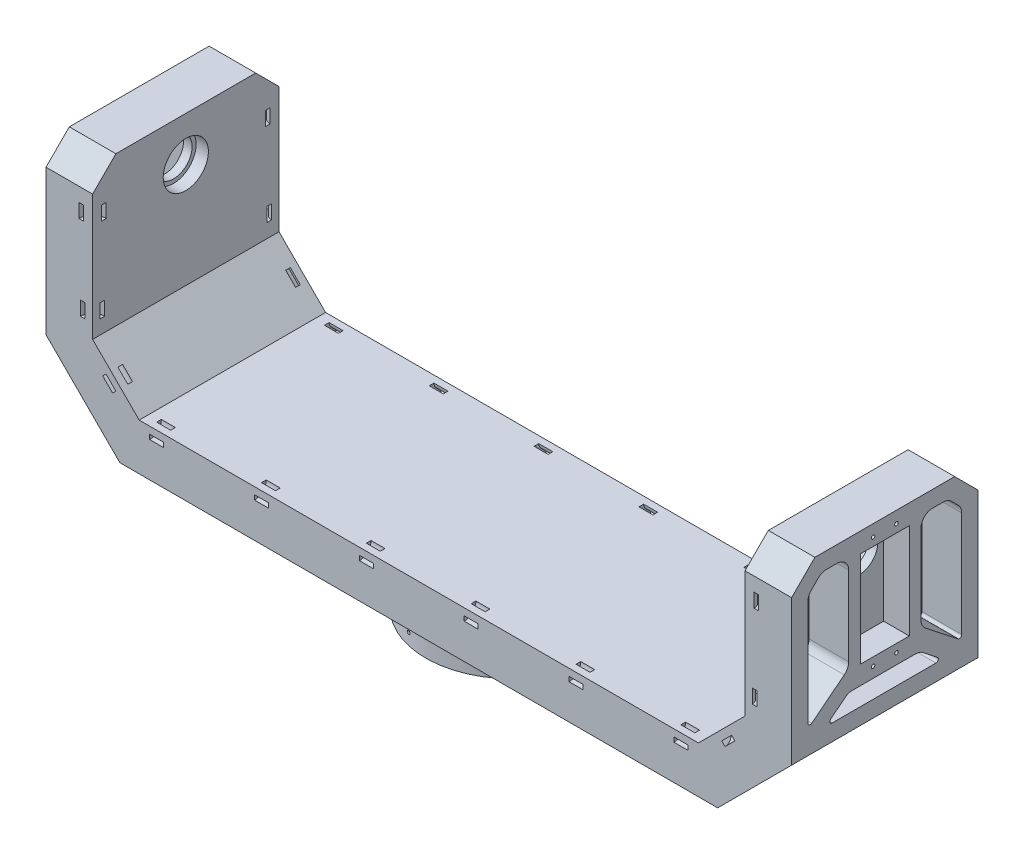
from build123d import *

# Parameters (mm, degrees)
EXTRUDE_1_DEPTH          = 40
CHAMFER_1_SIZE           = 10
SKETCH_3_R               = 0.75
CUT_EXTRUDE_1_DEPTH      = 10
SKETCH_4_W               = 21
SKETCH_4_H               = 41
CUT_EXTRUDE_2_DEPTH      = 11
SKETCH_8_R               = 37
SKETCH_8_R_2             = 33
EXTRUDE_2_DEPTH          = 10
CUT_EXTRUDE_4_DEPTH      = 18.5
SKETCH_9_W               = 7
SKETCH_9_H               = 20
EXTRUDE_3_DEPTH          = 6
SKETCH_10_W              = 8
SKETCH_10_H              = 20
CUT_EXTRUDE_5_DEPTH      = 10.5
SKETCH_11_R              = 0.75
CUT_EXTRUDE_6_DEPTH      = 10.5
PATTERN_CIRCULAR_1_COUNT = 7
CUT_EXTRUDE_7_DEPTH      = 17
CUT_EXTRUDE_8_DEPTH      = 15
CUT_EXTRUDE_START        = -17
CUT_EXTRUDE_9_DEPTH      = 17
CUT_EXTRUDE_10_DEPTH     = 17
CUT_EXTRUDE_11_DEPTH     = 37
SKETCH_17_R              = 0.75
CUT_EXTRUDE_13_DEPTH     = 10
SKETCH_18_W              = 6
SKETCH_18_H              = 2
SKETCH_20_W              = 2
SKETCH_20_H              = 6
MIRROR_7_COPY_2_SKETCH_W = 2
MIRROR_7_COPY_2_SKETCH_H = 6


with BuildPart() as part:
    # Эскиз1 → Бобышка-Вытянуть1 (new, symmetric)
    with BuildSketch(Plane.XY):
        Polygon((0, 0), (120, 0), (140, 20), (140, 84), (160, 84), (160, 11.715728753), (128.284271247, -20), (0, -20), align=None)
    extrude_1 = extrude(amount=EXTRUDE_1_DEPTH, both=True)

    # Зеркальное отражение1: Бобышка-Вытянуть1 across plane
    add(extrude_1.mirror(Plane(origin=(0, 0, 0), x_dir=(0, 0, 1), z_dir=(1, 0, 0))))

    # Фаска1
    chamfer_1_edges = [part.edges().sort_by_distance(p)[0] for p in [
        (150, 84, 40),
        (150, 84, -40),
        (-150, 84, -40),
        (-150, 84, 40),
    ]]
    chamfer(chamfer_1_edges, length=CHAMFER_1_SIZE)

    # Эскиз2 → Вырез-Повернуть1 (revolve, cut)
    with BuildSketch(Plane.XY):
        Polygon((140, 74.7), (145.277502044, 74.7), (145.277502044, 73), (160, 73), (160, 65), (140, 65), align=None)
    cut_revolve_1 = revolve(axis=Axis((49.854666059, 65, 0), (1, 0, 0)), mode=Mode.SUBTRACT)

    # Зеркальное отражение2: Вырез-Повернуть1 across plane
    add(cut_revolve_1.mirror(Plane(origin=(0, 0, 0), x_dir=(0, 0, 1), z_dir=(1, 0, 0))), mode=Mode.SUBTRACT)

    # Эскиз3 → Вырез-Вытянуть1 (cut)
    with BuildSketch(Plane.ZY.offset(160)):
        with Locations((-5, 79)):
            Circle(SKETCH_3_R)
        with Locations((5, 79)):
            Circle(SKETCH_3_R)
        with Locations((-5, 31)):
            Circle(SKETCH_3_R)
        with Locations((5, 31)):
            Circle(SKETCH_3_R)
    cut_extrude_1 = extrude(amount=-CUT_EXTRUDE_1_DEPTH, mode=Mode.SUBTRACT)

    # Эскиз4 → Вырез-Вытянуть2 (cut)
    with BuildSketch(Plane.ZY.offset(160)):
        with Locations((0, 55)):
            Rectangle(SKETCH_4_W, SKETCH_4_H)
    cut_extrude_2 = extrude(amount=-CUT_EXTRUDE_2_DEPTH, mode=Mode.SUBTRACT)

    # Эскиз8 → Бобышка-Вытянуть2 (add)
    with BuildSketch(Plane.XZ.offset(20)):
        Circle(SKETCH_8_R)
        Circle(SKETCH_8_R_2, mode=Mode.SUBTRACT)
    extrude(amount=EXTRUDE_2_DEPTH)

    # Эскиз7 → Вырез-Вытянуть4 (cut)
    with BuildSketch(Plane.XZ.offset(20)):
        with BuildLine():
            Line((10, 10.5), (-30, 10.5))
            ThreePointArc((-30, 10.5), (-30.353553391, 10.353553391), (-30.5, 10))
            Line((-30.5, 10), (-30.5, -10))
            ThreePointArc((-30.5, -10), (-30.353553391, -10.353553391), (-30, -10.5))
            Line((-30, -10.5), (10, -10.5))
            ThreePointArc((10, -10.5), (10.353553391, -10.353553391), (10.5, -10))
            Line((10.5, -10), (10.5, 10))
            ThreePointArc((10.5, 10), (10.353553391, 10.353553391), (10, 10.5))
        make_face()
    extrude(amount=-CUT_EXTRUDE_4_DEPTH, mode=Mode.SUBTRACT)

    # Эскиз9 → Бобышка-Вытянуть3 (add)
    with BuildSketch(Plane.XZ.offset(20)):
        with Locations((-35, 0)):
            Rectangle(SKETCH_9_W, SKETCH_9_H)
        with Locations((15, 0)):
            Rectangle(SKETCH_9_W, SKETCH_9_H)
    extrude(amount=EXTRUDE_3_DEPTH)

    # Эскиз10 → Вырез-Вытянуть5 (cut)
    with BuildSketch(Plane.XZ.offset(26)):
        with Locations((-34.5, 0)):
            Rectangle(SKETCH_10_W, SKETCH_10_H)
    extrude(amount=CUT_EXTRUDE_5_DEPTH, mode=Mode.SUBTRACT)

    # Эскиз11 → Вырез-Вытянуть6 (cut)
    with BuildSketch(Plane(origin=(40, 0, 0), x_dir=(0, 0, -1), z_dir=(1, 0, 0))):
        with Locations((0, -25)):
            Circle(SKETCH_11_R)
    cut_extrude_6 = extrude(amount=-CUT_EXTRUDE_6_DEPTH, mode=Mode.SUBTRACT)

    # Круговой массив1: Вырез-Вытянуть6 ×7 about axis
    pattern_circular_1_axis = Axis((0, -30, 0), (0, 1, 0))
    for i in range(1, PATTERN_CIRCULAR_1_COUNT):
        add(cut_extrude_6.rotate(pattern_circular_1_axis, i * 360 / PATTERN_CIRCULAR_1_COUNT), mode=Mode.SUBTRACT)

    # Зеркальное отражение3: Вырез-Вытянуть1, Вырез-Вытянуть2 across plane
    add(cut_extrude_1.mirror(Plane(origin=(0, 0, 0), x_dir=(0, 0, 1), z_dir=(1, 0, 0))), mode=Mode.SUBTRACT)
    add(cut_extrude_2.mirror(Plane(origin=(0, 0, 0), x_dir=(0, 0, 1), z_dir=(1, 0, 0))), mode=Mode.SUBTRACT)

    # Эскиз12 → Вырез-Вытянуть7 (cut)
    with BuildSketch(Plane.ZY.offset(160)):
        with BuildLine():
            Line((-31.535533906, 72.564971157), (-28.564971157, 75.535533906))
            ThreePointArc((-28.564971157, 75.535533906), (-26.942854413, 76.619397663), (-25.029437252, 77))
            Line((-25.029437252, 77), (-20.5, 77))
            ThreePointArc((-20.5, 77), (-16.964466094, 75.535533906), (-15.5, 72))
            Line((-15.5, 72), (-15.5, 37.93574072))
            ThreePointArc((-15.5, 37.93574072), (-16.000612532, 35.755026981), (-17.402204965, 34.010990293))
            Line((-17.402204965, 34.010990293), (-31.380440993, 22.978005912))
            ThreePointArc((-31.380440993, 22.978005912), (-32.436142748, 22.863078504), (-33, 23.762955997))
            Line((-33, 23.762955997), (-33, 69.029437252))
            ThreePointArc((-33, 69.029437252), (-32.619397663, 70.942854413), (-31.535533906, 72.564971157))
        make_face()
        with BuildLine():
            Line((22.601171863, 18.715728753), (-21.967697023, 18.715728753))
            ThreePointArc((-21.967697023, 18.715728753), (-22.912405995, 19.387818769), (-22.58725603, 20.500678838))
            Line((-22.58725603, 20.500678838), (-16.348705106, 25.424750428))
            ThreePointArc((-16.348705106, 25.424750428), (-14.890459988, 26.223544863), (-13.250910071, 26.5))
            Line((-13.250910071, 26.5), (13.884384911, 26.5))
            ThreePointArc((13.884384911, 26.5), (15.523934828, 26.223544863), (16.982179946, 25.424750428))
            Line((16.982179946, 25.424750428), (23.22073087, 20.500678838))
            ThreePointArc((23.22073087, 20.500678838), (23.545880835, 19.387818769), (22.601171863, 18.715728753))
        make_face()
        with BuildLine():
            Line((33, 23.762955997), (33, 69.029437252))
            ThreePointArc((33, 69.029437252), (32.619397663, 70.942854413), (31.535533906, 72.564971157))
            Line((31.535533906, 72.564971157), (28.564971157, 75.535533906))
            ThreePointArc((28.564971157, 75.535533906), (26.942854413, 76.619397663), (25.029437252, 77))
            Line((25.029437252, 77), (20.5, 77))
            ThreePointArc((20.5, 77), (16.964466094, 75.535533906), (15.5, 72))
            Line((15.5, 72), (15.5, 37.93574072))
            ThreePointArc((15.5, 37.93574072), (16.000612532, 35.755026981), (17.402204965, 34.010990293))
            Line((17.402204965, 34.010990293), (31.380440993, 22.978005912))
            ThreePointArc((31.380440993, 22.978005912), (32.436142748, 22.863078504), (33, 23.762955997))
        make_face()
    cut_extrude_7 = extrude(amount=-CUT_EXTRUDE_7_DEPTH, mode=Mode.SUBTRACT)

    # Эскиз13 → Вырез-Вытянуть8 (cut)
    with BuildSketch(Plane(origin=(-74.142135624, -74.142135624, 0), x_dir=(0, 0, 1), z_dir=(-0.7071067811865477, -0.7071067811865475, 0))):
        with BuildLine():
            Line((-16.529437252, 114.421356237), (16.529437252, 114.421356237))
            ThreePointArc((16.529437252, 114.421356237), (17.496975473, 113.67408097), (17.018478928, 112.549095818))
            Line((17.018478928, 112.549095818), (1.467125029, 103.83007107))
            ThreePointArc((1.467125029, 103.83007107), (0, 103.446852327), (-1.467125029, 103.83007107))
            Line((-1.467125029, 103.83007107), (-17.018478928, 112.549095818))
            ThreePointArc((-17.018478928, 112.549095818), (-17.496975473, 113.67408097), (-16.529437252, 114.421356237))
        make_face()
        with BuildLine():
            Line((1.467125029, 94.159827662), (17.018478928, 85.440802914))
            ThreePointArc((17.018478928, 85.440802914), (17.496975473, 84.315817762), (16.529437252, 83.568542495))
            Line((16.529437252, 83.568542495), (-16.529437252, 83.568542495))
            ThreePointArc((-16.529437252, 83.568542495), (-17.496975473, 84.315817762), (-17.018478928, 85.440802914))
            Line((-17.018478928, 85.440802914), (-1.467125029, 94.159827662))
            ThreePointArc((-1.467125029, 94.159827662), (0, 94.543046405), (1.467125029, 94.159827662))
        make_face()
        with BuildLine():
            Line((8.712628073, 98.122688947), (31.510958324, 85.340573192))
            ThreePointArc((31.510958324, 85.340573192), (32.505449465, 85.349977402), (33, 86.212833611))
            Line((33, 86.212833611), (33, 111.777065121))
            ThreePointArc((33, 111.777065121), (32.505449465, 112.63992133), (31.510958324, 112.64932554))
            Line((31.510958324, 112.64932554), (8.712628073, 99.867209785))
            ThreePointArc((8.712628073, 99.867209785), (8.201669749, 98.994949366), (8.712628073, 98.122688947))
        make_face()
        with BuildLine():
            Line((-31.510958324, 112.64932554), (-8.712628073, 99.867209785))
            ThreePointArc((-8.712628073, 99.867209785), (-8.201669749, 98.994949366), (-8.712628073, 98.122688947))
            Line((-8.712628073, 98.122688947), (-31.510958324, 85.340573192))
            ThreePointArc((-31.510958324, 85.340573192), (-32.505449465, 85.349977402), (-33, 86.212833611))
            Line((-33, 86.212833611), (-33, 111.777065121))
            ThreePointArc((-33, 111.777065121), (-32.505449465, 112.63992133), (-31.510958324, 112.64932554))
        make_face()
    cut_extrude_8 = extrude(amount=-CUT_EXTRUDE_8_DEPTH, mode=Mode.SUBTRACT)

    # Эскиз14 → Вырез-Вытянуть9 (cut)
    with BuildSketch(Plane.XZ.offset(20).offset(CUT_EXTRUDE_START)):
        with BuildLine():
            Line((-59.772989655, 1.691213331), (-37.427100322, 15.797512634))
            ThreePointArc((-37.427100322, 15.797512634), (-35.088117188, 15.650196296), (-34.49489825, 13.382899339))
            ThreePointArc((-34.49489825, 13.382899339), (-35.099741259, 11.705048636), (-35.623026261, 10))
            Line((-35.623026261, 10), (-38.5, 10))
            Line((-38.5, 10), (-38.5, -10))
            Line((-38.5, -10), (-35.623026261, -10))
            ThreePointArc((-35.623026261, -10), (-35.099741259, -11.705048636), (-34.49489825, -13.382899339))
            ThreePointArc((-34.49489825, -13.382899339), (-35.088117188, -15.650196296), (-37.427100322, -15.797512634))
            Line((-37.427100322, -15.797512634), (-59.772989655, -1.691213331))
            ThreePointArc((-59.772989655, -1.691213331), (-60.705376678, 0), (-59.772989655, 1.691213331))
        make_face()
        with BuildLine():
            Line((73.508735889, -33), (107.812697772, -33))
            ThreePointArc((107.812697772, -33), (109.733950835, -31.555685765), (108.880310749, -29.308786669))
            Line((108.880310749, -29.308786669), (74.576348866, -7.653709693))
            ThreePointArc((74.576348866, -7.653709693), (72.543133992, -7.593462783), (71.508735889, -9.344923024))
            Line((71.508735889, -9.344923024), (71.508735889, -31))
            ThreePointArc((71.508735889, -31), (72.094522327, -32.414213562), (73.508735889, -33))
        make_face()
        with BuildLine():
            Line((-78.244482123, 1.691213331), (-118.21665827, 26.924466397))
            ThreePointArc((-118.21665827, 26.924466397), (-120.249873144, 26.984713308), (-121.284271247, 25.233253066))
            Line((-121.284271247, 25.233253066), (-121.284271247, -25.233253066))
            ThreePointArc((-121.284271247, -25.233253066), (-120.249873144, -26.984713308), (-118.21665827, -26.924466397))
            Line((-118.21665827, -26.924466397), (-78.244482123, -1.691213331))
            ThreePointArc((-78.244482123, -1.691213331), (-77.3120951, 0), (-78.244482123, 1.691213331))
        make_face()
        with BuildLine():
            Line((-63.441122912, 7.653709693), (-29.137161029, 29.308786669))
            ThreePointArc((-29.137161029, 29.308786669), (-28.283520943, 31.555685765), (-30.204774006, 33))
            Line((-30.204774006, 33), (-64.508735889, 33))
            ThreePointArc((-64.508735889, 33), (-65.922949451, 32.414213562), (-66.508735889, 31))
            Line((-66.508735889, 31), (-66.508735889, 9.344923024))
            ThreePointArc((-66.508735889, 9.344923024), (-65.474337786, 7.593462783), (-63.441122912, 7.653709693))
        make_face()
        with BuildLine():
            Line((30.204774006, -33), (64.508735889, -33))
            ThreePointArc((64.508735889, -33), (65.922949451, -32.414213562), (66.508735889, -31))
            Line((66.508735889, -31), (66.508735889, -9.344923024))
            ThreePointArc((66.508735889, -9.344923024), (65.474337786, -7.593462783), (63.441122912, -7.653709693))
            Line((63.441122912, -7.653709693), (29.137161029, -29.308786669))
            ThreePointArc((29.137161029, -29.308786669), (28.283520943, -31.555685765), (30.204774006, -33))
        make_face()
        with BuildLine():
            Line((121.284271247, -25.233253066), (121.284271247, 25.233253066))
            ThreePointArc((121.284271247, 25.233253066), (120.249873144, 26.984713308), (118.21665827, 26.924466397))
            Line((118.21665827, 26.924466397), (78.244482123, 1.691213331))
            ThreePointArc((78.244482123, 1.691213331), (77.3120951, 0), (78.244482123, -1.691213331))
            Line((78.244482123, -1.691213331), (118.21665827, -26.924466397))
            ThreePointArc((118.21665827, -26.924466397), (120.249873144, -26.984713308), (121.284271247, -25.233253066))
        make_face()
        with BuildLine():
            Line((107.812697772, 33), (73.508735889, 33))
            ThreePointArc((73.508735889, 33), (72.094522327, 32.414213562), (71.508735889, 31))
            Line((71.508735889, 31), (71.508735889, 9.344923024))
            ThreePointArc((71.508735889, 9.344923024), (72.543133992, 7.593462783), (74.576348866, 7.653709693))
            Line((74.576348866, 7.653709693), (108.880310749, 29.308786669))
            ThreePointArc((108.880310749, 29.308786669), (109.733950835, 31.555685765), (107.812697772, 33))
        make_face()
        with BuildLine():
            Line((-74.576348866, 7.653709693), (-108.880310749, 29.308786669))
            ThreePointArc((-108.880310749, 29.308786669), (-109.733950835, 31.555685765), (-107.812697772, 33))
            Line((-107.812697772, 33), (-73.508735889, 33))
            ThreePointArc((-73.508735889, 33), (-72.094522327, 32.414213562), (-71.508735889, 31))
            Line((-71.508735889, 31), (-71.508735889, 9.344923024))
            ThreePointArc((-71.508735889, 9.344923024), (-72.543133992, 7.593462783), (-74.576348866, 7.653709693))
        make_face()
        with BuildLine():
            Line((-108.880310749, -29.308786669), (-74.576348866, -7.653709693))
            ThreePointArc((-74.576348866, -7.653709693), (-72.543133992, -7.593462783), (-71.508735889, -9.344923024))
            Line((-71.508735889, -9.344923024), (-71.508735889, -31))
            ThreePointArc((-71.508735889, -31), (-72.094522327, -32.414213562), (-73.508735889, -33))
            Line((-73.508735889, -33), (-107.812697772, -33))
            ThreePointArc((-107.812697772, -33), (-109.733950835, -31.555685765), (-108.880310749, -29.308786669))
        make_face()
        with BuildLine():
            Line((37.427100322, -15.797512634), (59.772989655, -1.691213331))
            ThreePointArc((59.772989655, -1.691213331), (60.705376678, 0), (59.772989655, 1.691213331))
            Line((59.772989655, 1.691213331), (37.427100322, 15.797512634))
            ThreePointArc((37.427100322, 15.797512634), (35.088117188, 15.650196296), (34.49489825, 13.382899339))
            ThreePointArc((34.49489825, 13.382899339), (37, 0), (34.49489825, -13.382899339))
            ThreePointArc((34.49489825, -13.382899339), (35.088117188, -15.650196296), (37.427100322, -15.797512634))
        make_face()
        with BuildLine():
            Line((-29.137161029, -29.308786669), (-63.441122912, -7.653709693))
            ThreePointArc((-63.441122912, -7.653709693), (-65.474337786, -7.593462783), (-66.508735889, -9.344923024))
            Line((-66.508735889, -9.344923024), (-66.508735889, -31))
            ThreePointArc((-66.508735889, -31), (-65.922949451, -32.414213562), (-64.508735889, -33))
            Line((-64.508735889, -33), (-30.204774006, -33))
            ThreePointArc((-30.204774006, -33), (-28.283520943, -31.555685765), (-29.137161029, -29.308786669))
        make_face()
        with BuildLine():
            Line((63.441122912, 7.653709693), (29.137161029, 29.308786669))
            ThreePointArc((29.137161029, 29.308786669), (28.283520943, 31.555685765), (30.204774006, 33))
            Line((30.204774006, 33), (64.508735889, 33))
            ThreePointArc((64.508735889, 33), (65.922949451, 32.414213562), (66.508735889, 31))
            Line((66.508735889, 31), (66.508735889, 9.344923024))
            ThreePointArc((66.508735889, 9.344923024), (65.474337786, 7.593462783), (63.441122912, 7.653709693))
        make_face()
    extrude(amount=CUT_EXTRUDE_9_DEPTH, mode=Mode.SUBTRACT)

    # Эскиз15 → Вырез-Вытянуть10 (cut)
    with BuildSketch(Plane.XZ.offset(20).offset(CUT_EXTRUDE_START)):
        with BuildLine():
            Line((-28.526303651, 15.5), (10.5, 15.5))
            ThreePointArc((10.5, 15.5), (11.207106781, 15.207106781), (11.5, 14.5))
            Line((11.5, 14.5), (11.5, 10))
            Line((11.5, 10), (11.5, -14.5))
            ThreePointArc((11.5, -14.5), (11.207106781, -15.207106781), (10.5, -15.5))
            Line((10.5, -15.5), (-28.526303651, -15.5))
            ThreePointArc((-28.526303651, -15.5), (-29.049216168, -15.352386356), (-29.41775064, -14.953125))
            ThreePointArc((-29.41775064, -14.953125), (-30.566140158, -12.438290713), (-31.5, -9.836157786))
            Line((-31.5, -9.836157786), (-31.5, 9.836157786))
            ThreePointArc((-31.5, 9.836157786), (-30.566140158, 12.438290713), (-29.41775064, 14.953125))
            ThreePointArc((-29.41775064, 14.953125), (-29.049216168, 15.352386356), (-28.526303651, 15.5))
        make_face()
        with BuildLine():
            Line((-21.719806629, 22.5), (21.719806629, 22.5))
            ThreePointArc((21.719806629, 22.5), (22.651035656, 23.135565507), (22.398550586, 24.234375))
            ThreePointArc((22.398550586, 24.234375), (0, 33), (-22.398550586, 24.234375))
            ThreePointArc((-22.398550586, 24.234375), (-22.651035656, 23.135565507), (-21.719806629, 22.5))
        make_face()
        with BuildLine():
            Line((-21.719806629, -22.5), (21.719806629, -22.5))
            ThreePointArc((21.719806629, -22.5), (22.651035656, -23.135565507), (22.398550586, -24.234375))
            ThreePointArc((22.398550586, -24.234375), (0, -33), (-22.398550586, -24.234375))
            ThreePointArc((-22.398550586, -24.234375), (-22.651035656, -23.135565507), (-21.719806629, -22.5))
        make_face()
        with BuildLine():
            Line((18.5, 10), (18.5, 14.5))
            ThreePointArc((18.5, 14.5), (18.792893219, 15.207106781), (19.5, 15.5))
            Line((19.5, 15.5), (28.526303651, 15.5))
            ThreePointArc((28.526303651, 15.5), (29.049216168, 15.352386356), (29.41775064, 14.953125))
            ThreePointArc((29.41775064, 14.953125), (33, 0), (29.41775064, -14.953125))
            ThreePointArc((29.41775064, -14.953125), (29.049216168, -15.352386356), (28.526303651, -15.5))
            Line((28.526303651, -15.5), (19.5, -15.5))
            ThreePointArc((19.5, -15.5), (18.792893219, -15.207106781), (18.5, -14.5))
            Line((18.5, -14.5), (18.5, 10))
        make_face()
    extrude(amount=CUT_EXTRUDE_10_DEPTH, mode=Mode.SUBTRACT)

    # Эскиз16 → Вырез-Вытянуть11 (cut)
    with BuildSketch(Plane.ZY.offset(-10.5)):
        with BuildLine():
            Line((-3, -12), (3, -12))
            ThreePointArc((3, -12), (3.707106781, -11.707106781), (4, -11))
            Line((4, -11), (4, -6))
            ThreePointArc((4, -6), (3.707106781, -5.292893219), (3, -5))
            Line((3, -5), (-3, -5))
            ThreePointArc((-3, -5), (-3.707106781, -5.292893219), (-4, -6))
            Line((-4, -6), (-4, -11))
            ThreePointArc((-4, -11), (-3.707106781, -11.707106781), (-3, -12))
        make_face()
    extrude(amount=-CUT_EXTRUDE_11_DEPTH, mode=Mode.SUBTRACT)

    # Зеркальное отражение4: Вырез-Вытянуть7, Вырез-Вытянуть8 across plane
    add(cut_extrude_7.mirror(Plane(origin=(0, 0, 0), x_dir=(0, 0, 1), z_dir=(1, 0, 0))), mode=Mode.SUBTRACT)
    add(cut_extrude_8.mirror(Plane(origin=(0, 0, 0), x_dir=(0, 0, 1), z_dir=(1, 0, 0))), mode=Mode.SUBTRACT)

    # Эскиз17 → Вырез-Вытянуть13 (cut)
    with BuildSketch(Plane.XZ.offset(26)):
        with Locations((-34, 5)):
            Circle(SKETCH_17_R)
        with Locations((14, 5)):
            Circle(SKETCH_17_R)
        with Locations((14, -5)):
            Circle(SKETCH_17_R)
        with Locations((-34, -5)):
            Circle(SKETCH_17_R)
    extrude(amount=-CUT_EXTRUDE_13_DEPTH, mode=Mode.SUBTRACT)

    # Эскиз18 → Вырез-Повернуть2 (revolve, cut)
    with BuildSketch(Plane.XY.offset(40)):
        with Locations((22.5, -4)):
            Rectangle(SKETCH_18_W, SKETCH_18_H)
        with Locations((67.5, -4)):
            Rectangle(SKETCH_18_W, SKETCH_18_H)
        with Locations((112.5, -4)):
            Rectangle(SKETCH_18_W, SKETCH_18_H)
        with Locations((-112.5, -4)):
            Rectangle(SKETCH_18_W, SKETCH_18_H)
        with Locations((-67.5, -4)):
            Rectangle(SKETCH_18_W, SKETCH_18_H)
        with Locations((-22.5, -4)):
            Rectangle(SKETCH_18_W, SKETCH_18_H)
    cut_revolve_2 = revolve(axis=Axis((0, 0, 40), (-1, 0, 0)), mode=Mode.SUBTRACT)

    # Эскиз19 → Вырез-Повернуть3 (revolve, cut)
    with BuildSketch(Plane.XY.offset(40)):
        Polygon((130, 5.757359313), (134.242640687, 10), (135.656854249, 8.585786438), (131.414213562, 4.343145751), align=None)
    cut_revolve_3 = revolve(axis=Axis((120, 0, 40), (-0.7071067811865476, -0.7071067811865476, 0)), mode=Mode.SUBTRACT)

    # Эскиз20 → Вырез-Повернуть4 (revolve, cut)
    with BuildSketch(Plane.XY.offset(40)):
        with Locations((144.183073621, 29)):
            Rectangle(SKETCH_20_W, SKETCH_20_H)
        with Locations((144.857192277, 65)):
            Rectangle(SKETCH_20_W, SKETCH_20_H)
    cut_revolve_4 = revolve(axis=Axis((140, 20, 40), (0, -1, 0)), mode=Mode.SUBTRACT)

    # Зеркальное отражение5: Вырез-Повернуть3 across plane
    add(cut_revolve_3.mirror(Plane(origin=(0, 0, 0), x_dir=(0, 0, 1), z_dir=(1, 0, 0))), mode=Mode.SUBTRACT)

    # Зеркальное отражение6: Вырез-Повернуть4 across plane
    add(cut_revolve_4.mirror(Plane(origin=(0, 0, 0), x_dir=(0, 0, 1), z_dir=(1, 0, 0))), mode=Mode.SUBTRACT)

    # Зеркальное отражение7: Вырез-Повернуть2, Вырез-Повернуть3, Вырез-Повернуть4 across plane
    add(cut_revolve_2.mirror(Plane.XY), mode=Mode.SUBTRACT)
    add(cut_revolve_3.mirror(Plane.XY), mode=Mode.SUBTRACT)
    add(cut_revolve_4.mirror(Plane.XY), mode=Mode.SUBTRACT)

    # Зеркальное отражение7 copy 1 sketch → Зеркальное отражение7 copy 1 (revolve, cut)
    with BuildSketch(Plane(origin=(0, 0, -40), x_dir=(-1, 0, 0), z_dir=(0, 0, -1))):
        Polygon((130, 5.757359313), (134.242640687, 10), (135.656854249, 8.585786438), (131.414213562, 4.343145751), align=None)
    revolve(axis=Axis((-120, 0, -40), (0.7071067811865476, -0.7071067811865476, 0)), mode=Mode.SUBTRACT)

    # Зеркальное отражение7 copy 2 sketch → Зеркальное отражение7 copy 2 (revolve, cut)
    with BuildSketch(Plane(origin=(0, 0, -40), x_dir=(-1, 0, 0), z_dir=(0, 0, -1))):
        with Locations((144.183073621, 29)):
            Rectangle(MIRROR_7_COPY_2_SKETCH_W, MIRROR_7_COPY_2_SKETCH_H)
        with Locations((144.857192277, 65)):
            Rectangle(MIRROR_7_COPY_2_SKETCH_W, MIRROR_7_COPY_2_SKETCH_H)
    revolve(axis=Axis((-140, 20, -40), (0, -1, 0)), mode=Mode.SUBTRACT)


solid = part.part
